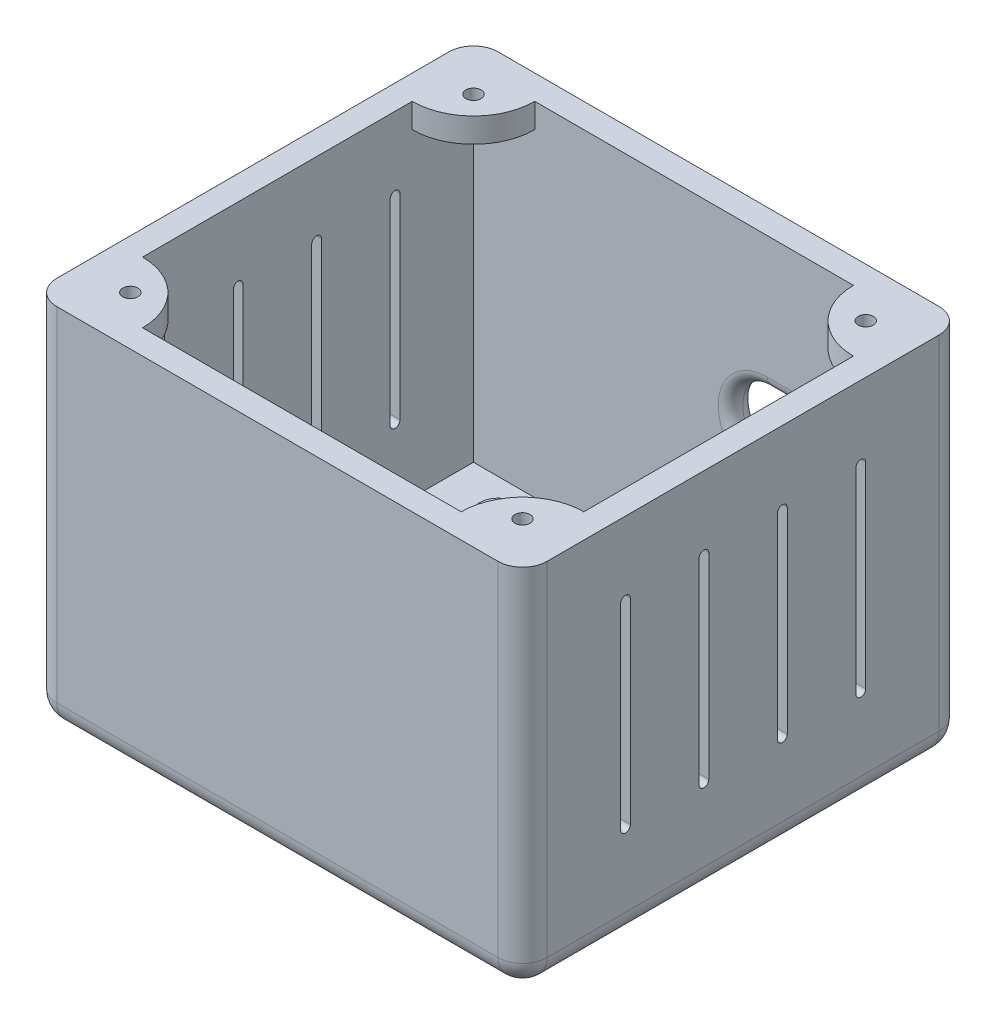
from build123d import *

# Parameters (mm, degrees)
SKETCH1_W                = 100
SKETCH1_H                = 90
SKETCH1_W_2              = 90
SKETCH1_H_2              = 80
BOSS_EXTRUDE1_DEPTH      = 70
SKETCH2_W                = 100
SKETCH2_H                = 90
BOSS_EXTRUDE2_DEPTH      = 5
FILLET1_R                = 5
SKETCH3_R                = 1.55
CUT_EXTRUDE1_DEPTH       = 146.430395722
SKETCH4_R                = 3
CUT_EXTRUDE2_DEPTH       = 2.5
CUT_EXTRUDE3_DEPTH       = 146.430395722
SKETCH6_W                = 12.5
SKETCH6_H                = 5
REVOLVE2_ANGLE           = 90
SKETCH7_W                = 12.5
SKETCH7_H                = 5
REVOLVE3_ANGLE           = 90
SKETCH8_W                = 12.5
SKETCH8_H                = 5
REVOLVE4_ANGLE           = 90
SKETCH9_W                = 12.5
SKETCH9_H                = 5
REVOLVE5_ANGLE           = 90
SKETCH10_R               = 1.55
CUT_EXTRUDE5_DEPTH       = 5
SKETCH13_R               = 3.75
BOSS_EXTRUDE3_DEPTH      = 5
SKETCH14_R               = 1.55
CUT_EXTRUDE7_DEPTH       = 146.430395722
FILLET3_R                = 5
CUT_EXTRUDE8_DEPTH       = 5
FILLET4_R                = 2.5
CUT_EXTRUDE11_DEPTH      = 149.744747806
CUT_EXTRUDE11_DEPTH_BACK = 149.744747806


with BuildPart() as part:
    # Sketch1 → Boss-Extrude1 (new body)
    with BuildSketch(Plane(origin=(0, 0, 0), x_dir=(1, 0, 0), z_dir=(0, 1, 0))):
        with Locations((45, 40)):
            Rectangle(SKETCH1_W, SKETCH1_H)
        with Locations((45, 40)):
            Rectangle(SKETCH1_W_2, SKETCH1_H_2, mode=Mode.SUBTRACT)
    extrude(amount=BOSS_EXTRUDE1_DEPTH)

    # Sketch2 → Boss-Extrude2 (add)
    with BuildSketch(Plane(origin=(0, 0, 0), x_dir=(-1, 0, 0), z_dir=(0, -1, 0))):
        with Locations((-45, 40)):
            Rectangle(SKETCH2_W, SKETCH2_H)
    extrude(amount=BOSS_EXTRUDE2_DEPTH)

    # Fillet1
    fillet1_edges = [part.edges().sort_by_distance(p)[0] for p in [
        (-5, 32.5, -85),
        (95, 32.5, -85),
        (95, 32.5, 5),
        (-5, 32.5, 5),
    ]]
    fillet(fillet1_edges, radius=FILLET1_R)

    # Sketch3 → Cut-Extrude1 (cut, through all)
    with BuildSketch(Plane(origin=(0, 0, 0), x_dir=(1, 0, 0), z_dir=(0, 1, 0))):
        with Locations(Location((16.5, 68.5, 0), (0, 0, 270))):
            Circle(SKETCH3_R)
        with Locations(Location((16.5, 11.5, 0), (0, 0, 270))):
            Circle(SKETCH3_R)
        with Locations(Location((73.5, 11.5, 0), (0, 0, 270))):
            Circle(SKETCH3_R)
        with Locations(Location((73.5, 68.5, 0), (0, 0, 270))):
            Circle(SKETCH3_R)
    extrude(amount=-CUT_EXTRUDE1_DEPTH, mode=Mode.SUBTRACT)

    # Sketch4 → Cut-Extrude2 (cut)
    with BuildSketch(Plane(origin=(0, -5, 0), x_dir=(-1, 0, 0), z_dir=(0, -1, 0))):
        with Locations(Location((-16.5, 11.5, 0), (0, 0, 90))):
            Circle(SKETCH4_R)
        with Locations(Location((-73.5, 11.5, 0), (0, 0, 90))):
            Circle(SKETCH4_R)
        with Locations(Location((-73.5, 68.5, 0), (0, 0, 90))):
            Circle(SKETCH4_R)
        with Locations(Location((-16.5, 68.5, 0), (0, 0, 90))):
            Circle(SKETCH4_R)
    extrude(amount=-CUT_EXTRUDE2_DEPTH, mode=Mode.SUBTRACT)

    # Sketch5 → Cut-Extrude3 (cut, through all)
    with BuildSketch(Plane(origin=(0, 0, 0), x_dir=(1, 0, 0), z_dir=(0, 1, 0))):
        with BuildLine():
            Line((26, 65), (26, 15))
            ThreePointArc((26, 15), (25, 14), (24, 15))
            Line((24, 15), (24, 65))
            ThreePointArc((24, 65), (25, 66), (26, 65))
        make_face()
        with BuildLine():
            Line((66, 65), (66, 15))
            ThreePointArc((66, 15), (65, 14), (64, 15))
            Line((64, 15), (64, 65))
            ThreePointArc((64, 65), (65, 66), (66, 65))
        make_face()
        with BuildLine():
            Line((52.666666667, 65), (52.666666667, 15))
            ThreePointArc((52.666666667, 15), (51.666666667, 14), (50.666666667, 15))
            Line((50.666666667, 15), (50.666666667, 65))
            ThreePointArc((50.666666667, 65), (51.666666667, 66), (52.666666667, 65))
        make_face()
        with BuildLine():
            Line((39.333333333, 65), (39.333333333, 15))
            ThreePointArc((39.333333333, 15), (38.333333333, 14), (37.333333333, 15))
            Line((37.333333333, 15), (37.333333333, 65))
            ThreePointArc((37.333333333, 65), (38.333333333, 66), (39.333333333, 65))
        make_face()
    extrude(amount=-CUT_EXTRUDE3_DEPTH, mode=Mode.SUBTRACT)

    # Sketch6 → Revolve2 (revolve)
    with BuildSketch(Plane.XY.offset(-80)):
        with Locations((6.25, 67.5)):
            Rectangle(SKETCH6_W, SKETCH6_H)
    revolve(axis=Axis((0, 70, -80), (0, -1, 0)), revolution_arc=REVOLVE2_ANGLE)

    # Sketch7 → Revolve3 (revolve)
    with BuildSketch(Plane.XY.offset(-80)):
        with Locations((83.75, 67.5)):
            Rectangle(SKETCH7_W, SKETCH7_H)
    revolve(axis=Axis((90, 70, -80), (0, 1, 0)), revolution_arc=REVOLVE3_ANGLE)

    # Sketch8 → Revolve4 (revolve)
    with BuildSketch(Plane(origin=(0, 0, 0), x_dir=(-1, 0, 0), z_dir=(0, 0, -1))):
        with Locations((-83.75, 67.5)):
            Rectangle(SKETCH8_W, SKETCH8_H)
    revolve(axis=Axis((90, 70, 0), (0, -1, 0)), revolution_arc=REVOLVE4_ANGLE)

    # Sketch9 → Revolve5 (revolve)
    with BuildSketch(Plane(origin=(0, 0, 0), x_dir=(-1, 0, 0), z_dir=(0, 0, -1))):
        with Locations((-6.25, 67.5)):
            Rectangle(SKETCH9_W, SKETCH9_H)
    revolve(axis=Axis((0, 70, 0), (0, 1, 0)), revolution_arc=REVOLVE5_ANGLE)

    # Sketch10 → Cut-Extrude5 (cut)
    with BuildSketch(Plane(origin=(0, 70, 0), x_dir=(1, 0, 0), z_dir=(0, 1, 0))):
        with Locations(Location((5, 75, 0), (0, 0, 270))):
            Circle(SKETCH10_R)
        with Locations(Location((85, 75, 0), (0, 0, 270))):
            Circle(SKETCH10_R)
        with Locations(Location((85, 5, 0), (0, 0, 270))):
            Circle(SKETCH10_R)
        with Locations(Location((5, 5, 0), (0, 0, 270))):
            Circle(SKETCH10_R)
    extrude(amount=-CUT_EXTRUDE5_DEPTH, mode=Mode.SUBTRACT)

    # Sketch13 → Boss-Extrude3 (add)
    with BuildSketch(Plane(origin=(0, 0, 0), x_dir=(1, 0, 0), z_dir=(0, 1, 0))):
        with Locations(Location((16.5, 68.5, 0), (0, 0, 90))):
            Circle(SKETCH13_R)
        with Locations(Location((73.5, 68.5, 0), (0, 0, 90))):
            Circle(SKETCH13_R)
        with Locations(Location((73.5, 11.5, 0), (0, 0, 90))):
            Circle(SKETCH13_R)
        with Locations(Location((16.5, 11.5, 0), (0, 0, 90))):
            Circle(SKETCH13_R)
    extrude(amount=BOSS_EXTRUDE3_DEPTH)

    # Sketch14 → Cut-Extrude7 (cut, through all)
    with BuildSketch(Plane(origin=(0, 0, 0), x_dir=(-1, 0, 0), z_dir=(0, -1, 0))):
        with Locations(Location((-73.5, 68.5, 0), (0, 0, 270))):
            Circle(SKETCH14_R)
        with Locations(Location((-73.5, 11.5, 0), (0, 0, 270))):
            Circle(SKETCH14_R)
        with Locations(Location((-16.5, 11.5, 0), (0, 0, 270))):
            Circle(SKETCH14_R)
        with Locations(Location((-16.5, 68.5, 0), (0, 0, 270))):
            Circle(SKETCH14_R)
    extrude(amount=-CUT_EXTRUDE7_DEPTH, mode=Mode.SUBTRACT)

    # Fillet3
    fillet3_edges = [part.edges().sort_by_distance(p)[0] for p in [
        (-5, -5, -40),
        (45, -5, -85),
        (95, -5, -40),
        (45, -5, 5),
        (-3.535533906, -5, 3.535533906),
        (93.535533906, -5, 3.535533906),
        (93.535533906, -5, -83.535533906),
        (-3.535533906, -5, -83.535533906),
    ]]
    fillet(fillet3_edges, radius=FILLET3_R)

    # Sketch15 → Cut-Extrude8 (cut)
    with BuildSketch(Plane(origin=(0, 0, -85), x_dir=(-1, 0, 0), z_dir=(0, 0, -1))):
        with BuildLine():
            Line((-65, 42.5), (-59.92, 42.5))
            ThreePointArc((-59.92, 42.5), (-52.42, 35), (-59.92, 27.5))
            Line((-59.92, 27.5), (-65, 27.5))
            ThreePointArc((-65, 27.5), (-72.5, 35), (-65, 42.5))
        make_face()
    extrude(amount=-CUT_EXTRUDE8_DEPTH, mode=Mode.SUBTRACT)

    # Fillet4
    fillet4_edges = [part.edges().sort_by_distance(p)[0] for p in [
        (62.46, 42.5, -85),
        (62.46, 27.5, -85),
        (62.46, 42.5, -80),
        (62.46, 27.5, -80),
        (52.42, 35, -85),
        (52.42, 35, -80),
        (72.5, 35, -85),
        (72.5, 35, -80),
    ]]
    fillet(fillet4_edges, radius=FILLET4_R - 0.0001)  # a hair under: the kernel refuses the full size

    # Sketch16 → Cut-Extrude11 (cut, two sides: drawn at the far end of the back side and taken through both)
    with BuildSketch(Plane(origin=(-5, 0, 0), x_dir=(0, 0, -1), z_dir=(1, 0, 0)).offset(-CUT_EXTRUDE11_DEPTH_BACK)):
        with BuildLine():
            Line((65, 55), (65, 15))
            ThreePointArc((65, 15), (64, 14), (63, 15))
            Line((63, 15), (63, 55))
            ThreePointArc((63, 55), (64, 56), (65, 55))
        make_face()
        with BuildLine():
            Line((47, 15), (47, 55))
            ThreePointArc((47, 55), (48, 56), (49, 55))
            Line((49, 55), (49, 15))
            ThreePointArc((49, 15), (48, 14), (47, 15))
        make_face()
        with BuildLine():
            Line((17, 55), (17, 15))
            ThreePointArc((17, 15), (16, 14), (15, 15))
            Line((15, 15), (15, 55))
            ThreePointArc((15, 55), (16, 56), (17, 55))
        make_face()
        with BuildLine():
            Line((33, 55), (33, 15))
            ThreePointArc((33, 15), (32, 14), (31, 15))
            Line((31, 15), (31, 55))
            ThreePointArc((31, 55), (32, 56), (33, 55))
        make_face()
    extrude(amount=CUT_EXTRUDE11_DEPTH + CUT_EXTRUDE11_DEPTH_BACK, mode=Mode.SUBTRACT)


solid = part.part
